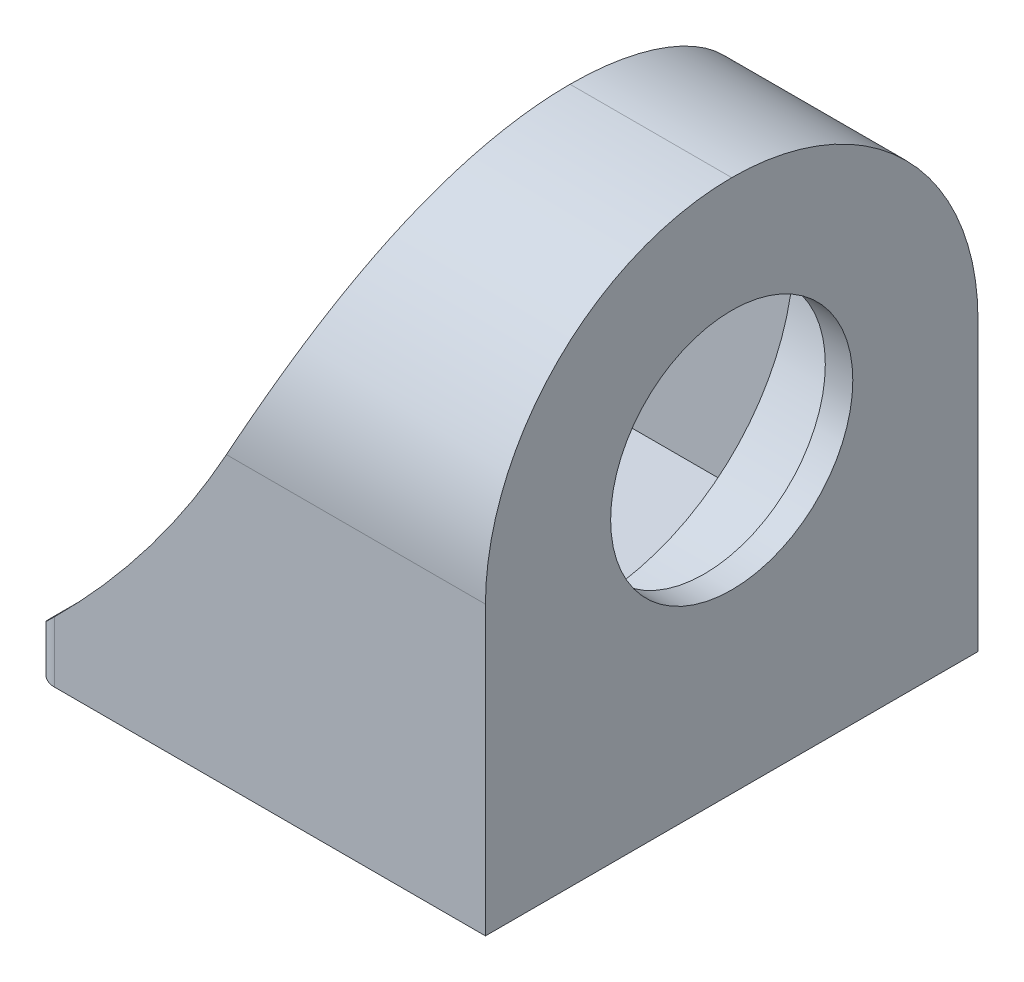
from build123d import *

# Parameters (mm, degrees)
SKETCH_1_W          = 110
SKETCH_1_H          = 120
EXTRUDE_1_DEPTH     = 130
SKETCH_3_W          = 75.6
SKETCH_3_H          = 120
CUT_EXTRUDE_1_DEPTH = 130
EXTRUDE_2_DEPTH     = 5
EXTRUDE_3_DEPTH     = 110
FILLET_START        = -8.112141349
FILLET_2_DEPTH      = 28.712141349
FILLET_START_2      = -55
FILLET_2_2_DEPTH    = 110
FILLET_3_R          = 60
FILLET_4_R          = 5
SKETCH_6_R          = 49.5
CUT_EXTRUDE_2_DEPTH = 27.7
SKETCH_7_R          = 29.5
CUT_EXTRUDE_5_DEPTH = 177.552797006
SKETCH_8_R          = 2.5
SKETCH_8_R_2        = 2
CUT_EXTRUDE_6_DEPTH = 10


with BuildPart() as part:
    # 草图1 → 凸台-拉伸1 (new body)
    with BuildSketch(Plane(origin=(0, 0, 0), x_dir=(1, 0, 0), z_dir=(0, 1, 0))):
        Rectangle(SKETCH_1_W, SKETCH_1_H)
    extrude(amount=EXTRUDE_1_DEPTH)

    # 草图3 → 切除-拉伸1 (cut)
    with BuildSketch(Plane.XY.offset(60)):
        with Locations((-17.2, 70)):
            Rectangle(SKETCH_3_W, SKETCH_3_H)
    extrude(amount=-CUT_EXTRUDE_1_DEPTH, mode=Mode.SUBTRACT)

    # 草图4 → 凸台-拉伸2 (add)
    with BuildSketch(Plane.XY.offset(60)):
        with BuildLine():
            Line((20.6, 130), (15.6, 130))
            add(Edge.make_bspline(
                [(-55, 10), (-2.665013162, 59.248795935), (15.6, 130)],
                knots=[0, 0, 0, 1, 1, 1], degree=2))
            Line((-55, 10), (20.6, 10))
            Line((20.6, 10), (20.6, 130))
        make_face()
    extrude_2 = extrude(amount=-EXTRUDE_2_DEPTH)

    # 镜向1: 凸台-拉伸2 across plane
    add(extrude_2.mirror(Plane.XY))

    # 草图5 → 凸台-拉伸3 (add)
    with BuildSketch(Plane(origin=(0, 0, 55), x_dir=(-1, 0, 0), z_dir=(0, 0, -1))):
        with BuildLine():
            Line((-20.6, 130), (-20.6, 125))
            Line((-20.6, 125), (-14.2592003, 125))
            add(Edge.make_bspline(
                [(-14.259200299, 125), (-14.95110103, 127.486430307), (-15.600000021, 130.000000082)],
                knots=[0.964473117, 0.964473117, 0.964473117, 1, 1, 1], degree=2))
            Line((-15.600000021, 130.000000082), (-20.6, 130))
        make_face()
    extrude(amount=EXTRUDE_3_DEPTH)

    # 圆角2: read off the stored shape, not the designer's step
    # 圆角2 outline → 圆角2 (add)
    with BuildSketch(Plane.YZ.offset(FILLET_START)):
        with BuildLine():
            Line((125, 55), (70, 55))
            ThreePointArc((70, 55), (108.890872965, 38.890872965), (125, 0))
            Line((125, 0), (125, 55))
        make_face()
        with BuildLine():
            Line((125, -55), (125, 0))
            ThreePointArc((125, 0), (108.890872965, -38.890872965), (70, -55))
            Line((70, -55), (125, -55))
        make_face()
    extrude(amount=FILLET_2_DEPTH)

    # Fillet 2 2 outline → Fillet 2 2 (cut)
    with BuildSketch(Plane.XY.offset(FILLET_START_2)):
        with BuildLine():
            add(Edge.make_bspline(
                [(14.259200299, 125), (6.078935587, 95.603213424), (-8.112141272, 69.999999958)],
                knots=[0.035526883, 0.035526883, 0.035526883, 0.455557239, 0.455557239, 0.455557239], degree=2))
            Line((14.259200299, 125), (-8.112141349, 125))
            Line((-8.112141349, 125), (-8.112141272, 69.999999958))
        make_face()
    extrude(amount=FILLET_2_2_DEPTH, mode=Mode.SUBTRACT)

    # 圆角3
    # the kernel refuses this fillet: 60 mm, written as the material it takes off along each edge
    with BuildSketch(Plane(origin=(205, 130, 60), x_dir=(0, -1, 0), z_dir=(-1, 0, 0)), Plane(origin=(205, 130, -60), x_dir=(0, 0, 1), z_dir=(-1, 0, 0))) as fillet_3_piece_1:
        with BuildLine():
            CenterArc((FILLET_3_R, -FILLET_3_R), FILLET_3_R, 90, 90)
            Line((0, -FILLET_3_R), (0, 0))
            Line((0, 0), (FILLET_3_R, 0))
        make_face()
    extrude(amount=339.4, mode=Mode.SUBTRACT)

    # 圆角4
    fillet_4_edges = [part.edges().sort_by_distance(p)[0] for p in [
        (-55, 5, 60),
        (-55, 5, -60),
    ]]
    fillet(fillet_4_edges, radius=FILLET_4_R)

    # 草图6 → 切除-拉伸2 (cut)
    with BuildSketch(Plane.ZY.offset(-20.6)):
        with Locations(Location((0, 72.500997163, 0), (0, 0, 270))):
            Circle(SKETCH_6_R)
    extrude(amount=-CUT_EXTRUDE_2_DEPTH, mode=Mode.SUBTRACT)

    # 草图7 → 切除-拉伸5 (cut, through all)
    with BuildSketch(Plane.ZY.offset(-48.3)):
        with Locations(Location((0, 72.500997163, 0), (0, 0, 270))):
            Circle(SKETCH_7_R)
    extrude(amount=-CUT_EXTRUDE_5_DEPTH, mode=Mode.SUBTRACT)

    # 草图8 → 切除-拉伸6 (cut)
    with BuildSketch(Plane.XZ):
        with Locations(Location((0, 0, 0), (0, 0, 270))):
            Circle(SKETCH_8_R)
        with Locations(Location((0, 17.25, 0), (0, 0, 270))):
            Circle(SKETCH_8_R_2)
        with Locations(Location((0, -17.25, 0), (0, 0, 270))):
            Circle(SKETCH_8_R_2)
    extrude(amount=-CUT_EXTRUDE_6_DEPTH, mode=Mode.SUBTRACT)


solid = part.part
